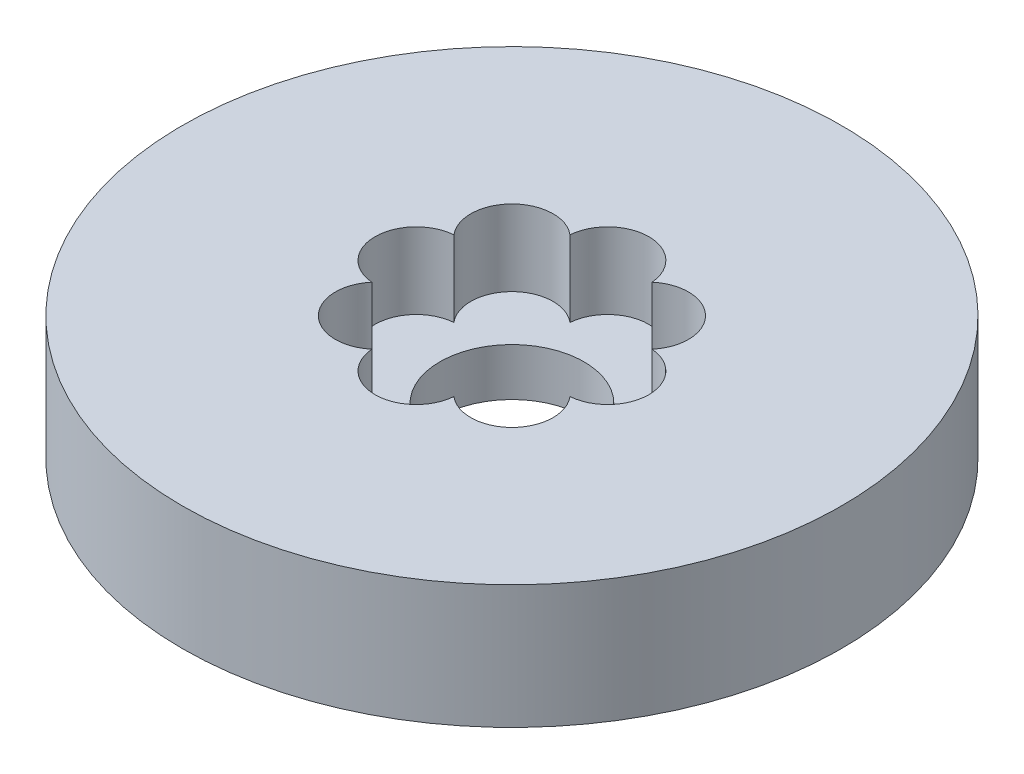
from build123d import *

# Parameters (mm, degrees)
SKETCH1_R           = 80
BOSS_EXTRUDE1_DEPTH = 30
SKETCH2_R           = 17.5
CUT_EXTRUDE1_DEPTH  = 118.046999107
SKETCH3_R           = 10
CUT_EXTRUDE2_DEPTH  = 18.432040154
CIRPATTERN1_COUNT   = 8


with BuildPart() as part:
    # Sketch1 → Boss-Extrude1 (new body)
    with BuildSketch(Plane(origin=(0, 0, 0), x_dir=(1, 0, 0), z_dir=(0, 1, 0))):
        Circle(SKETCH1_R)
    extrude(amount=BOSS_EXTRUDE1_DEPTH)

    # Sketch2 → Cut-Extrude1 (cut, through all)
    with BuildSketch(Plane(origin=(0, 0, 0), x_dir=(1, 0, 0), z_dir=(0, 1, 0))):
        Circle(SKETCH2_R)
    extrude(amount=CUT_EXTRUDE1_DEPTH, mode=Mode.SUBTRACT)

    # Sketch3 → Cut-Extrude2 (cut)
    with BuildSketch(Plane(origin=(0, 30, 0), x_dir=(1, 0, 0), z_dir=(0, 1, 0))):
        with Locations((-23.230150503, 0)):
            Circle(SKETCH3_R)
    cut_extrude2 = extrude(amount=-CUT_EXTRUDE2_DEPTH, mode=Mode.SUBTRACT)

    # CirPattern1: Cut-Extrude2 ×8 about axis
    cirpattern1_axis = Axis((0, 0, 0), (0, 1, 0))
    for i in range(1, CIRPATTERN1_COUNT):
        add(cut_extrude2.rotate(cirpattern1_axis, i * 360 / CIRPATTERN1_COUNT), mode=Mode.SUBTRACT)


solid = part.part
